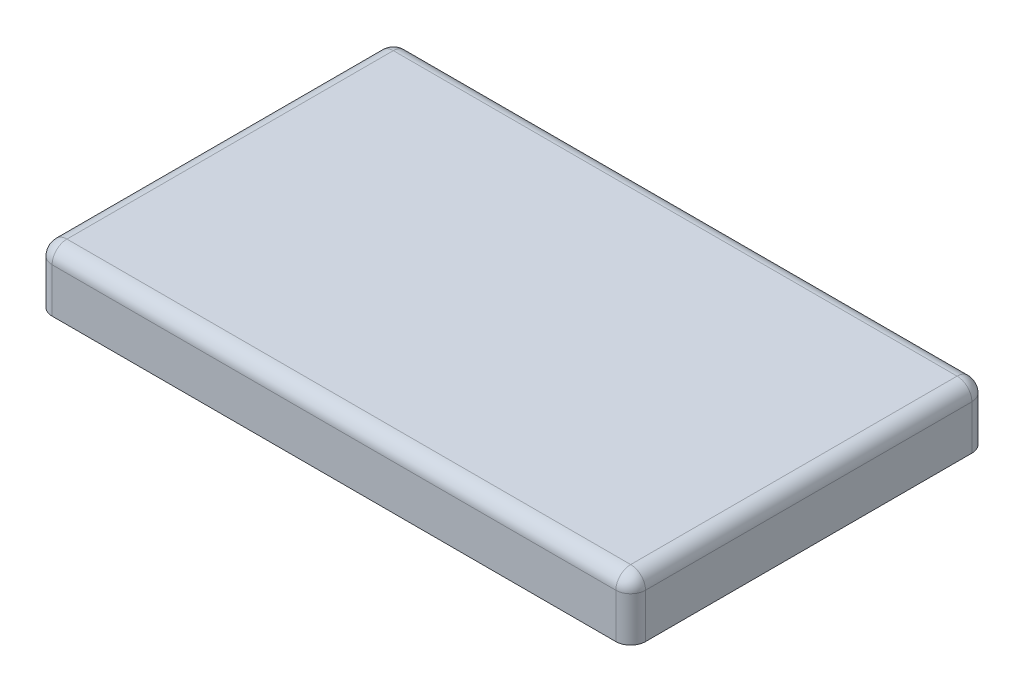
from build123d import *

# Parameters (mm, degrees)
BOSS_EXTRUDE1_DEPTH = 10
SHELL1_T            = -1.25
FILLET1_R           = 2.5
CHAMFER1_SIZE       = 1.25


with BuildPart() as part:
    # Sketch1 → Boss-Extrude1 (new body)
    with BuildSketch(Plane(origin=(0, 0, 0), x_dir=(1, 0, 0), z_dir=(0, 1, 0))):
        with BuildLine():
            Line((-47.5, -30), (47.5, -30))
            ThreePointArc((47.5, -30), (49.267766953, -29.267766953), (50, -27.5))
            Line((50, -27.5), (50, 27.5))
            ThreePointArc((50, 27.5), (49.267766953, 29.267766953), (47.5, 30))
            Line((47.5, 30), (-47.5, 30))
            ThreePointArc((-47.5, 30), (-49.267766953, 29.267766953), (-50, 27.5))
            Line((-50, 27.5), (-50, -27.5))
            ThreePointArc((-50, -27.5), (-49.267766953, -29.267766953), (-47.5, -30))
        make_face()
    extrude(amount=BOSS_EXTRUDE1_DEPTH)

    # Shell1
    shell1_openings = [part.faces().sort_by_distance(p)[0] for p in [
        (0, 0, 0),
    ]]
    offset(amount=SHELL1_T, openings=shell1_openings, kind=Kind.INTERSECTION)

    # Fillet1
    fillet1_edges = [part.edges().sort_by_distance(p)[0] for p in [
        (49.267766953, 10, 29.267766953),
        (50, 10, 0),
        (49.267766953, 10, -29.267766953),
        (0, 10, -30),
        (-49.267766953, 10, -29.267766953),
        (-50, 10, 0),
        (-49.267766953, 10, 29.267766953),
        (0, 10, 30),
    ]]
    fillet(fillet1_edges, radius=FILLET1_R)

    # Chamfer1
    chamfer1_edges = [part.edges().sort_by_distance(p)[0] for p in [
        (-48.383883476, 0, 28.383883476),
        (0, 0, 28.75),
        (48.383883476, 0, 28.383883476),
        (48.75, 0, 0),
        (48.383883476, 0, -28.383883476),
        (0, 0, -28.75),
        (-48.383883476, 0, -28.383883476),
        (-48.75, 0, 0),
    ]]
    chamfer(chamfer1_edges, length=CHAMFER1_SIZE - 0.0001)  # a hair under: the kernel refuses the full size


solid = part.part
